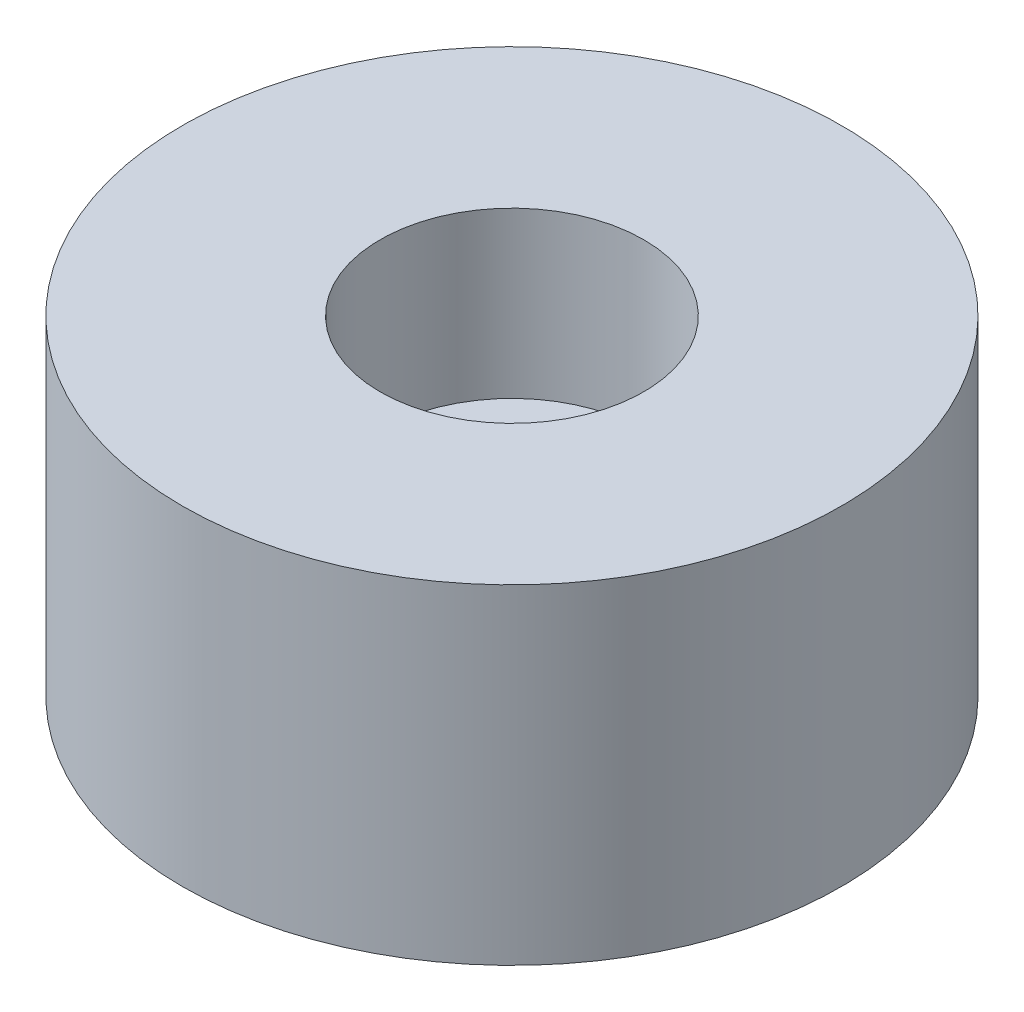
from build123d import *

# Parameters (mm, degrees)
SKETCH1_R           = 4
BOSS_EXTRUDE1_DEPTH = 4
SKETCH2_R           = 1.6
CUT_EXTRUDE1_DEPTH  = 2


with BuildPart() as part:
    # Sketch1 → Boss-Extrude1 (new body)
    with BuildSketch(Plane(origin=(0, 0, 0), x_dir=(1, 0, 0), z_dir=(0, 1, 0))):
        Circle(SKETCH1_R)
    extrude(amount=BOSS_EXTRUDE1_DEPTH)

    # Sketch2 → Cut-Extrude1 (cut)
    with BuildSketch(Plane(origin=(0, 4, 0), x_dir=(1, 0, 0), z_dir=(0, 1, 0))):
        Circle(SKETCH2_R)
    extrude(amount=-CUT_EXTRUDE1_DEPTH, mode=Mode.SUBTRACT)


solid = part.part
